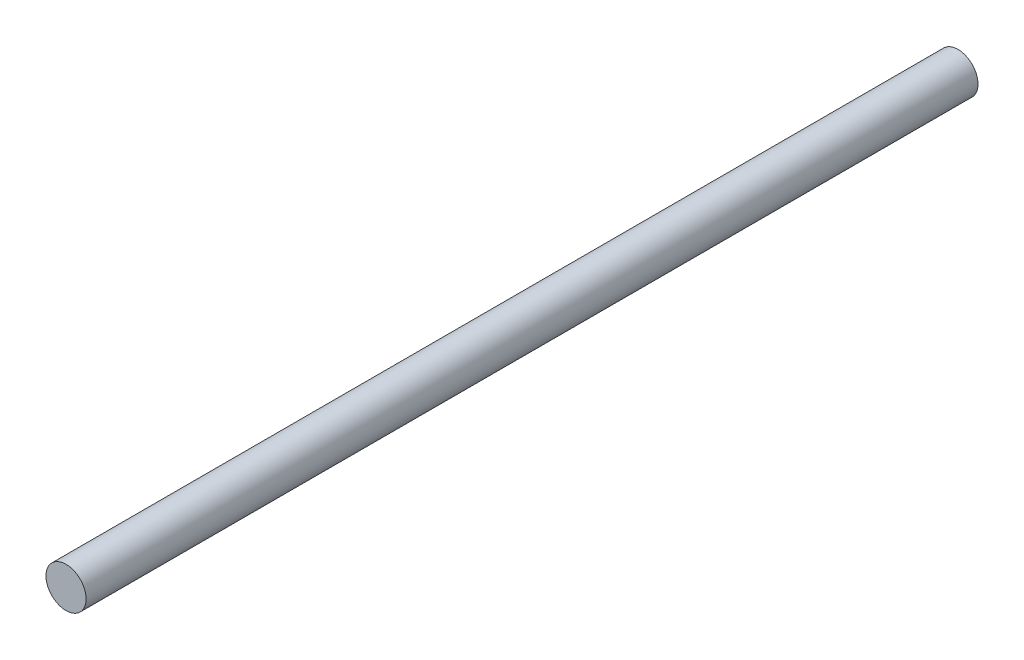
from build123d import *

# Parameters (mm, degrees)
SKETCH3_R           = 4
BOSS_EXTRUDE1_DEPTH = 177.8


with BuildPart() as part:
    # Sketch3 → Boss-Extrude1 (new body)
    with BuildSketch(Plane.XY):
        Circle(SKETCH3_R)
    extrude(amount=BOSS_EXTRUDE1_DEPTH)


solid = part.part
